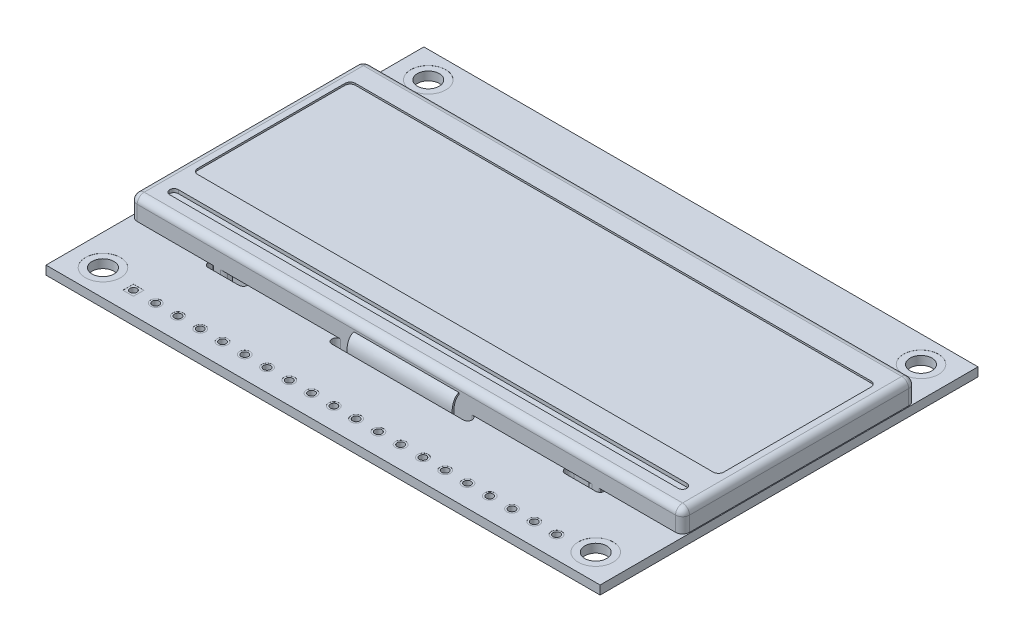
from build123d import *
from build123d.topology import SkipClean

# Parameters (mm, degrees)
SKETCH1_W           = 63.2
SKETCH1_H           = 43.1
BOSS_EXTRUDE1_DEPTH = 1
CUT_EXTRUDE1_REACH  = 78.504
SKETCH2_R           = 1.25
CUT_EXTRUDE2_REACH  = 78.504
SKETCH3_R           = 0.4
SKETCH4_W           = 63
SKETCH4_H           = 26.6
BOSS_EXTRUDE2_DEPTH = 2.5
CUT_EXTRUDE3_REACH  = 78.538
SKETCH5_W           = 16
SKETCH5_H           = 1
FILLET1_R           = 0.5
CUT_EXTRUDE4_DEPTH  = 0.2
SKETCH7_W           = 59
SKETCH7_H           = 1
CUT_EXTRUDE5_DEPTH  = 0.4
FILLET2_R           = 0.5
FILLET3_R           = 0.8
FILLET4_R           = 0.8
SKETCH8_W           = 4.5
SKETCH8_H           = 1
CUT_EXTRUDE6_DEPTH  = 1
FILLET5_R           = 0.5
SKETCH9_W           = 17
SKETCH9_H           = 4
BOSS_EXTRUDE3_DEPTH = 2
SKETCH10_W          = 13
SKETCH10_H          = 2
CUT_EXTRUDE7_DEPTH  = 0.4
SKETCH12_W          = 12
SKETCH12_H          = 0.2
SKETCH14_R          = 2
CUT_EXTRUDE8_DEPTH  = 0.01
SKETCH15_W          = 1.2
SKETCH15_H          = 1.2
CUT_EXTRUDE9_DEPTH  = 0.01
SKETCH16_R          = 0.6
CUT_EXTRUDE10_DEPTH = 0.01
CUT_EXTRUDE11_START = -0.01
SKETCH17_R          = 2
CUT_EXTRUDE11_DEPTH = 0.01
SKETCH18_W          = 1.75
SKETCH18_H          = 0.5
BOSS_EXTRUDE4_DEPTH = 1
CHAMFER1_SIZE       = 0.5
BOSS_EXTRUDE5_DEPTH = 1.2
FILLET6_R           = 0.8
FILLET7_R           = 0.1
SKETCH20_W          = 1.2
SKETCH20_H          = 1.2
CUT_EXTRUDE12_DEPTH = 0.01
CUT_EXTRUDE16_START = -0.01
SKETCH23_R          = 0.6
CUT_EXTRUDE16_DEPTH = 0.01


# Some blends are built 0.0001 mm under size
with BuildPart() as part:
    # Sketch1 → Boss-Extrude1 (new body)
    with BuildSketch(Plane(origin=(0, 0, 0), x_dir=(1, 0, 0), z_dir=(0, 1, 0))):
        with Locations((31.6, 21.55)):
            Rectangle(SKETCH1_W, SKETCH1_H)
    extrude(amount=BOSS_EXTRUDE1_DEPTH)

    # Sketch2 → Cut-Extrude1 (cut, up to next)
    with BuildSketch(Plane(origin=(0, 1, 0), x_dir=(1, 0, 0), z_dir=(0, 1, 0)), mode=Mode.PRIVATE) as cut_extrude1_sk1:
        with Locations(Location((3.5, 40.1, 0), (0, 0, 270))):
            Circle(SKETCH2_R)
    cut_extrude1_tool1 = extrude(cut_extrude1_sk1.sketch, amount=-CUT_EXTRUDE1_REACH, mode=Mode.PRIVATE) & part.part
    # Sketch2 → Cut-Extrude1 (cut, up to next)
    with BuildSketch(Plane(origin=(0, 1, 0), x_dir=(1, 0, 0), z_dir=(0, 1, 0)), mode=Mode.PRIVATE) as cut_extrude1_sk2:
        with Locations(Location((59.7, 40.1, 0), (0, 0, 270))):
            Circle(SKETCH2_R)
    cut_extrude1_tool2 = extrude(cut_extrude1_sk2.sketch, amount=-CUT_EXTRUDE1_REACH, mode=Mode.PRIVATE) & part.part
    # Sketch2 → Cut-Extrude1 (cut, up to next)
    with BuildSketch(Plane(origin=(0, 1, 0), x_dir=(1, 0, 0), z_dir=(0, 1, 0)), mode=Mode.PRIVATE) as cut_extrude1_sk3:
        with Locations(Location((59.7, 3, 0), (0, 0, 270))):
            Circle(SKETCH2_R)
    cut_extrude1_tool3 = extrude(cut_extrude1_sk3.sketch, amount=-CUT_EXTRUDE1_REACH, mode=Mode.PRIVATE) & part.part
    # Sketch2 → Cut-Extrude1 (cut, up to next)
    with BuildSketch(Plane(origin=(0, 1, 0), x_dir=(1, 0, 0), z_dir=(0, 1, 0)), mode=Mode.PRIVATE) as cut_extrude1_sk4:
        with Locations(Location((3.5, 3, 0), (0, 0, 270))):
            Circle(SKETCH2_R)
    cut_extrude1_tool4 = extrude(cut_extrude1_sk4.sketch, amount=-CUT_EXTRUDE1_REACH, mode=Mode.PRIVATE) & part.part
    add(cut_extrude1_tool1.solids().sort_by_distance((3.5, 1, -40.1))[0], mode=Mode.SUBTRACT)
    add(cut_extrude1_tool2.solids().sort_by_distance((59.7, 1, -40.1))[0], mode=Mode.SUBTRACT)
    add(cut_extrude1_tool3.solids().sort_by_distance((59.7, 1, -3))[0], mode=Mode.SUBTRACT)
    add(cut_extrude1_tool4.solids().sort_by_distance((3.5, 1, -3))[0], mode=Mode.SUBTRACT)

    # Sketch3 → Cut-Extrude2 (cut, up to next)
    with BuildSketch(Plane(origin=(0, 1, 0), x_dir=(1, 0, 0), z_dir=(0, 1, 0)), mode=Mode.PRIVATE) as cut_extrude2_sk1:
        with Locations(Location((7.47, 2.5, 0), (0, 0, 270))):
            Circle(SKETCH3_R)
    cut_extrude2_tool1 = extrude(cut_extrude2_sk1.sketch, amount=-CUT_EXTRUDE2_REACH, mode=Mode.PRIVATE) & part.part
    # Sketch3 → Cut-Extrude2 (cut, up to next)
    with BuildSketch(Plane(origin=(0, 1, 0), x_dir=(1, 0, 0), z_dir=(0, 1, 0)), mode=Mode.PRIVATE) as cut_extrude2_sk2:
        with Locations(Location((10.01, 2.5, 0), (0, 0, 270))):
            Circle(SKETCH3_R)
    cut_extrude2_tool2 = extrude(cut_extrude2_sk2.sketch, amount=-CUT_EXTRUDE2_REACH, mode=Mode.PRIVATE) & part.part
    # Sketch3 → Cut-Extrude2 (cut, up to next)
    with BuildSketch(Plane(origin=(0, 1, 0), x_dir=(1, 0, 0), z_dir=(0, 1, 0)), mode=Mode.PRIVATE) as cut_extrude2_sk3:
        with Locations(Location((12.55, 2.5, 0), (0, 0, 270))):
            Circle(SKETCH3_R)
    cut_extrude2_tool3 = extrude(cut_extrude2_sk3.sketch, amount=-CUT_EXTRUDE2_REACH, mode=Mode.PRIVATE) & part.part
    # Sketch3 → Cut-Extrude2 (cut, up to next)
    with BuildSketch(Plane(origin=(0, 1, 0), x_dir=(1, 0, 0), z_dir=(0, 1, 0)), mode=Mode.PRIVATE) as cut_extrude2_sk4:
        with Locations(Location((15.09, 2.5, 0), (0, 0, 270))):
            Circle(SKETCH3_R)
    cut_extrude2_tool4 = extrude(cut_extrude2_sk4.sketch, amount=-CUT_EXTRUDE2_REACH, mode=Mode.PRIVATE) & part.part
    # Sketch3 → Cut-Extrude2 (cut, up to next)
    with BuildSketch(Plane(origin=(0, 1, 0), x_dir=(1, 0, 0), z_dir=(0, 1, 0)), mode=Mode.PRIVATE) as cut_extrude2_sk5:
        with Locations(Location((17.63, 2.5, 0), (0, 0, 270))):
            Circle(SKETCH3_R)
    cut_extrude2_tool5 = extrude(cut_extrude2_sk5.sketch, amount=-CUT_EXTRUDE2_REACH, mode=Mode.PRIVATE) & part.part
    # Sketch3 → Cut-Extrude2 (cut, up to next)
    with BuildSketch(Plane(origin=(0, 1, 0), x_dir=(1, 0, 0), z_dir=(0, 1, 0)), mode=Mode.PRIVATE) as cut_extrude2_sk6:
        with Locations(Location((20.17, 2.5, 0), (0, 0, 270))):
            Circle(SKETCH3_R)
    cut_extrude2_tool6 = extrude(cut_extrude2_sk6.sketch, amount=-CUT_EXTRUDE2_REACH, mode=Mode.PRIVATE) & part.part
    # Sketch3 → Cut-Extrude2 (cut, up to next)
    with BuildSketch(Plane(origin=(0, 1, 0), x_dir=(1, 0, 0), z_dir=(0, 1, 0)), mode=Mode.PRIVATE) as cut_extrude2_sk7:
        with Locations(Location((22.71, 2.5, 0), (0, 0, 270))):
            Circle(SKETCH3_R)
    cut_extrude2_tool7 = extrude(cut_extrude2_sk7.sketch, amount=-CUT_EXTRUDE2_REACH, mode=Mode.PRIVATE) & part.part
    # Sketch3 → Cut-Extrude2 (cut, up to next)
    with BuildSketch(Plane(origin=(0, 1, 0), x_dir=(1, 0, 0), z_dir=(0, 1, 0)), mode=Mode.PRIVATE) as cut_extrude2_sk8:
        with Locations(Location((25.25, 2.5, 0), (0, 0, 270))):
            Circle(SKETCH3_R)
    cut_extrude2_tool8 = extrude(cut_extrude2_sk8.sketch, amount=-CUT_EXTRUDE2_REACH, mode=Mode.PRIVATE) & part.part
    # Sketch3 → Cut-Extrude2 (cut, up to next)
    with BuildSketch(Plane(origin=(0, 1, 0), x_dir=(1, 0, 0), z_dir=(0, 1, 0)), mode=Mode.PRIVATE) as cut_extrude2_sk9:
        with Locations(Location((27.79, 2.5, 0), (0, 0, 270))):
            Circle(SKETCH3_R)
    cut_extrude2_tool9 = extrude(cut_extrude2_sk9.sketch, amount=-CUT_EXTRUDE2_REACH, mode=Mode.PRIVATE) & part.part
    # Sketch3 → Cut-Extrude2 (cut, up to next)
    with BuildSketch(Plane(origin=(0, 1, 0), x_dir=(1, 0, 0), z_dir=(0, 1, 0)), mode=Mode.PRIVATE) as cut_extrude2_sk10:
        with Locations(Location((30.33, 2.5, 0), (0, 0, 270))):
            Circle(SKETCH3_R)
    cut_extrude2_tool10 = extrude(cut_extrude2_sk10.sketch, amount=-CUT_EXTRUDE2_REACH, mode=Mode.PRIVATE) & part.part
    # Sketch3 → Cut-Extrude2 (cut, up to next)
    with BuildSketch(Plane(origin=(0, 1, 0), x_dir=(1, 0, 0), z_dir=(0, 1, 0)), mode=Mode.PRIVATE) as cut_extrude2_sk11:
        with Locations(Location((32.87, 2.5, 0), (0, 0, 270))):
            Circle(SKETCH3_R)
    cut_extrude2_tool11 = extrude(cut_extrude2_sk11.sketch, amount=-CUT_EXTRUDE2_REACH, mode=Mode.PRIVATE) & part.part
    # Sketch3 → Cut-Extrude2 (cut, up to next)
    with BuildSketch(Plane(origin=(0, 1, 0), x_dir=(1, 0, 0), z_dir=(0, 1, 0)), mode=Mode.PRIVATE) as cut_extrude2_sk12:
        with Locations(Location((35.41, 2.5, 0), (0, 0, 270))):
            Circle(SKETCH3_R)
    cut_extrude2_tool12 = extrude(cut_extrude2_sk12.sketch, amount=-CUT_EXTRUDE2_REACH, mode=Mode.PRIVATE) & part.part
    # Sketch3 → Cut-Extrude2 (cut, up to next)
    with BuildSketch(Plane(origin=(0, 1, 0), x_dir=(1, 0, 0), z_dir=(0, 1, 0)), mode=Mode.PRIVATE) as cut_extrude2_sk13:
        with Locations(Location((37.95, 2.5, 0), (0, 0, 270))):
            Circle(SKETCH3_R)
    cut_extrude2_tool13 = extrude(cut_extrude2_sk13.sketch, amount=-CUT_EXTRUDE2_REACH, mode=Mode.PRIVATE) & part.part
    # Sketch3 → Cut-Extrude2 (cut, up to next)
    with BuildSketch(Plane(origin=(0, 1, 0), x_dir=(1, 0, 0), z_dir=(0, 1, 0)), mode=Mode.PRIVATE) as cut_extrude2_sk14:
        with Locations(Location((40.49, 2.5, 0), (0, 0, 270))):
            Circle(SKETCH3_R)
    cut_extrude2_tool14 = extrude(cut_extrude2_sk14.sketch, amount=-CUT_EXTRUDE2_REACH, mode=Mode.PRIVATE) & part.part
    # Sketch3 → Cut-Extrude2 (cut, up to next)
    with BuildSketch(Plane(origin=(0, 1, 0), x_dir=(1, 0, 0), z_dir=(0, 1, 0)), mode=Mode.PRIVATE) as cut_extrude2_sk15:
        with Locations(Location((43.03, 2.5, 0), (0, 0, 270))):
            Circle(SKETCH3_R)
    cut_extrude2_tool15 = extrude(cut_extrude2_sk15.sketch, amount=-CUT_EXTRUDE2_REACH, mode=Mode.PRIVATE) & part.part
    # Sketch3 → Cut-Extrude2 (cut, up to next)
    with BuildSketch(Plane(origin=(0, 1, 0), x_dir=(1, 0, 0), z_dir=(0, 1, 0)), mode=Mode.PRIVATE) as cut_extrude2_sk16:
        with Locations(Location((45.57, 2.5, 0), (0, 0, 270))):
            Circle(SKETCH3_R)
    cut_extrude2_tool16 = extrude(cut_extrude2_sk16.sketch, amount=-CUT_EXTRUDE2_REACH, mode=Mode.PRIVATE) & part.part
    # Sketch3 → Cut-Extrude2 (cut, up to next)
    with BuildSketch(Plane(origin=(0, 1, 0), x_dir=(1, 0, 0), z_dir=(0, 1, 0)), mode=Mode.PRIVATE) as cut_extrude2_sk17:
        with Locations(Location((48.11, 2.5, 0), (0, 0, 270))):
            Circle(SKETCH3_R)
    cut_extrude2_tool17 = extrude(cut_extrude2_sk17.sketch, amount=-CUT_EXTRUDE2_REACH, mode=Mode.PRIVATE) & part.part
    # Sketch3 → Cut-Extrude2 (cut, up to next)
    with BuildSketch(Plane(origin=(0, 1, 0), x_dir=(1, 0, 0), z_dir=(0, 1, 0)), mode=Mode.PRIVATE) as cut_extrude2_sk18:
        with Locations(Location((50.65, 2.5, 0), (0, 0, 270))):
            Circle(SKETCH3_R)
    cut_extrude2_tool18 = extrude(cut_extrude2_sk18.sketch, amount=-CUT_EXTRUDE2_REACH, mode=Mode.PRIVATE) & part.part
    # Sketch3 → Cut-Extrude2 (cut, up to next)
    with BuildSketch(Plane(origin=(0, 1, 0), x_dir=(1, 0, 0), z_dir=(0, 1, 0)), mode=Mode.PRIVATE) as cut_extrude2_sk19:
        with Locations(Location((53.19, 2.5, 0), (0, 0, 270))):
            Circle(SKETCH3_R)
    cut_extrude2_tool19 = extrude(cut_extrude2_sk19.sketch, amount=-CUT_EXTRUDE2_REACH, mode=Mode.PRIVATE) & part.part
    # Sketch3 → Cut-Extrude2 (cut, up to next)
    with BuildSketch(Plane(origin=(0, 1, 0), x_dir=(1, 0, 0), z_dir=(0, 1, 0)), mode=Mode.PRIVATE) as cut_extrude2_sk20:
        with Locations(Location((55.73, 2.5, 0), (0, 0, 270))):
            Circle(SKETCH3_R)
    cut_extrude2_tool20 = extrude(cut_extrude2_sk20.sketch, amount=-CUT_EXTRUDE2_REACH, mode=Mode.PRIVATE) & part.part
    add(cut_extrude2_tool1.solids().sort_by_distance((7.47, 1, -2.5))[0], mode=Mode.SUBTRACT)
    add(cut_extrude2_tool2.solids().sort_by_distance((10.01, 1, -2.5))[0], mode=Mode.SUBTRACT)
    add(cut_extrude2_tool3.solids().sort_by_distance((12.55, 1, -2.5))[0], mode=Mode.SUBTRACT)
    add(cut_extrude2_tool4.solids().sort_by_distance((15.09, 1, -2.5))[0], mode=Mode.SUBTRACT)
    add(cut_extrude2_tool5.solids().sort_by_distance((17.63, 1, -2.5))[0], mode=Mode.SUBTRACT)
    add(cut_extrude2_tool6.solids().sort_by_distance((20.17, 1, -2.5))[0], mode=Mode.SUBTRACT)
    add(cut_extrude2_tool7.solids().sort_by_distance((22.71, 1, -2.5))[0], mode=Mode.SUBTRACT)
    add(cut_extrude2_tool8.solids().sort_by_distance((25.25, 1, -2.5))[0], mode=Mode.SUBTRACT)
    add(cut_extrude2_tool9.solids().sort_by_distance((27.79, 1, -2.5))[0], mode=Mode.SUBTRACT)
    add(cut_extrude2_tool10.solids().sort_by_distance((30.33, 1, -2.5))[0], mode=Mode.SUBTRACT)
    add(cut_extrude2_tool11.solids().sort_by_distance((32.87, 1, -2.5))[0], mode=Mode.SUBTRACT)
    add(cut_extrude2_tool12.solids().sort_by_distance((35.41, 1, -2.5))[0], mode=Mode.SUBTRACT)
    add(cut_extrude2_tool13.solids().sort_by_distance((37.95, 1, -2.5))[0], mode=Mode.SUBTRACT)
    add(cut_extrude2_tool14.solids().sort_by_distance((40.49, 1, -2.5))[0], mode=Mode.SUBTRACT)
    add(cut_extrude2_tool15.solids().sort_by_distance((43.03, 1, -2.5))[0], mode=Mode.SUBTRACT)
    add(cut_extrude2_tool16.solids().sort_by_distance((45.57, 1, -2.5))[0], mode=Mode.SUBTRACT)
    add(cut_extrude2_tool17.solids().sort_by_distance((48.11, 1, -2.5))[0], mode=Mode.SUBTRACT)
    add(cut_extrude2_tool18.solids().sort_by_distance((50.65, 1, -2.5))[0], mode=Mode.SUBTRACT)
    add(cut_extrude2_tool19.solids().sort_by_distance((53.19, 1, -2.5))[0], mode=Mode.SUBTRACT)
    add(cut_extrude2_tool20.solids().sort_by_distance((55.73, 1, -2.5))[0], mode=Mode.SUBTRACT)

    # Sketch4 → Boss-Extrude2 (add)
    with BuildSketch(Plane(origin=(0, 1, 0), x_dir=(1, 0, 0), z_dir=(0, 1, 0))):
        with Locations((31.6, 22.8)):
            Rectangle(SKETCH4_W, SKETCH4_H)
    extrude(amount=BOSS_EXTRUDE2_DEPTH)

    # Sketch5 → Cut-Extrude3 (cut, up to next)
    with BuildSketch(Plane(origin=(0, 1, 0), x_dir=(1, 0, 0), z_dir=(0, 1, 0)), mode=Mode.PRIVATE) as cut_extrude3_sk1:
        with Locations((31.6, 9)):
            Rectangle(SKETCH5_W, SKETCH5_H)
    cut_extrude3_tool1 = extrude(cut_extrude3_sk1.sketch, amount=-CUT_EXTRUDE3_REACH, mode=Mode.PRIVATE) & part.part
    add(cut_extrude3_tool1.solids().sort_by_distance((31.6, 1, -9))[0], mode=Mode.SUBTRACT)

    # Fillet1
    fillet1_edges = [part.edges().sort_by_distance(p)[0] for p in [
        (39.6, 0.5, -8.5),
        (39.6, 0.5, -9.5),
        (23.6, 0.5, -8.5),
        (23.6, 0.5, -9.5),
    ]]
    fillet(fillet1_edges, radius=FILLET1_R - 0.0001)  # a hair under: the kernel refuses the full size

    # Sketch6 → Cut-Extrude4 (cut)
    with BuildSketch(Plane(origin=(0, 3.5, 0), x_dir=(1, 0, 0), z_dir=(0, 1, 0))):
        with BuildLine():
            Line((2.2, 33.1), (61, 33.1))
            ThreePointArc((61, 33.1), (61.424264069, 32.924264069), (61.6, 32.5))
            Line((61.6, 32.5), (61.6, 15.7))
            ThreePointArc((61.6, 15.7), (61.424264069, 15.275735931), (61, 15.1))
            Line((61, 15.1), (2.2, 15.1))
            ThreePointArc((2.2, 15.1), (1.775735931, 15.275735931), (1.6, 15.7))
            Line((1.6, 15.7), (1.6, 32.5))
            ThreePointArc((1.6, 32.5), (1.775735931, 32.924264069), (2.2, 33.1))
        make_face()
    extrude(amount=-CUT_EXTRUDE4_DEPTH, mode=Mode.SUBTRACT)

    # Sketch7 → Cut-Extrude5 (cut)
    with BuildSketch(Plane(origin=(0, 3.5, 0), x_dir=(1, 0, 0), z_dir=(0, 1, 0))):
        with Locations((31.6, 12)):
            Rectangle(SKETCH7_W, SKETCH7_H)
    extrude(amount=-CUT_EXTRUDE5_DEPTH, mode=Mode.SUBTRACT)

    # Fillet2
    fillet2_edges = [part.edges().sort_by_distance(p)[0] for p in [
        (61.1, 3.3, -11.5),
        (61.1, 3.3, -12.5),
        (2.1, 3.3, -11.5),
        (2.1, 3.3, -12.5),
    ]]
    fillet(fillet2_edges, radius=FILLET2_R - 0.0001)  # a hair under: the kernel refuses the full size

    # Fillet3
    fillet3_edges = [part.edges().sort_by_distance(p)[0] for p in [
        (0.1, 2.25, -36.1),
        (0.1, 2.25, -9.5),
        (63.1, 2.25, -9.5),
        (63.1, 2.25, -36.1),
    ]]
    fillet(fillet3_edges, radius=FILLET3_R)

    # Fillet4
    fillet4_edges = [part.edges().sort_by_distance(p)[0] for p in [
        (31.6, 3.5, -36.1),
        (63.1, 3.5, -22.8),
        (0.1, 3.5, -22.8),
        (31.6, 3.5, -9.5),
        (0.334314575, 3.5, -35.865685425),
        (0.334314575, 3.5, -9.734314575),
        (62.865685425, 3.5, -9.734314575),
        (62.865685425, 3.5, -35.865685425),
    ]]
    fillet(fillet4_edges, radius=FILLET4_R)

    # Sketch8 → Cut-Extrude6 (cut)
    with BuildSketch(Plane.XZ):
        with Locations((51.95, -9.5)):
            Rectangle(SKETCH8_W, SKETCH8_H)
        with Locations((11.25, -9.5)):
            Rectangle(SKETCH8_W, SKETCH8_H)
        with Locations((11.25, -36.1)):
            Rectangle(SKETCH8_W, SKETCH8_H)
        with Locations((51.95, -36.1)):
            Rectangle(SKETCH8_W, SKETCH8_H)
    extrude(amount=-CUT_EXTRUDE6_DEPTH, mode=Mode.SUBTRACT)

    # Fillet5
    fillet5_edges = [part.edges().sort_by_distance(p)[0] for p in [
        (13.5, 0.5, -9),
        (13.5, 0.5, -10),
        (9, 0.5, -10),
        (9, 0.5, -9),
        (13.5, 0.5, -35.6),
        (13.5, 0.5, -36.6),
        (9, 0.5, -35.6),
        (9, 0.5, -36.6),
        (49.7, 0.5, -9),
        (49.7, 0.5, -10),
        (54.2, 0.5, -9),
        (54.2, 0.5, -10),
        (49.7, 0.5, -35.6),
        (49.7, 0.5, -36.6),
        (54.2, 0.5, -35.6),
        (54.2, 0.5, -36.6),
    ]]
    fillet(fillet5_edges, radius=FILLET5_R - 0.0001)  # a hair under: the kernel refuses the full size

    # Sketch9 → Boss-Extrude3 (add)
    with BuildSketch(Plane.XZ):
        with Locations((31.6, -40.1)):
            Rectangle(SKETCH9_W, SKETCH9_H)
    extrude(amount=BOSS_EXTRUDE3_DEPTH)

    # Sketch10 → Cut-Extrude7 (cut)
    with BuildSketch(Plane(origin=(0, 0, -42.1), x_dir=(-1, 0, 0), z_dir=(0, 0, -1))):
        with Locations((-31.6, -1)):
            Rectangle(SKETCH10_W, SKETCH10_H)
    extrude(amount=-CUT_EXTRUDE7_DEPTH, mode=Mode.SUBTRACT)

    # Sweep2: sweep along a path in Sketch13
    with BuildLine() as sweep2_path:  # in the path sketch's own coordinates; laid on its plane below (add() does not lay a ready-made edge on the line's plane)
        add(Edge.make_bspline(
            [(38.1, -0.982874857), (31.693367937, -1.195153262), (28.241433931, -1.402191769), (7.916516179, -4.95738453), (8.854522638, 2.143849397), (9.538601565, 2.350278671)],
            knots=[0, 0, 0, 0, 0.344257494, 0.890734915, 1, 1, 1, 1], degree=3))
    # Sketch12 → Sweep2 (sweep)
    with BuildSketch(Plane.XY.offset(-38.1)):
        with Locations((31.6, -1)):
            Rectangle(SKETCH12_W, SKETCH12_H)
    sweep(path=Plane(origin=(31.6, 0, 0), x_dir=(0, 0, -1), z_dir=(1, 0, 0)) * sweep2_path.line)

    # Sketch14 → Cut-Extrude8 (cut)
    with BuildSketch(Plane(origin=(0, 1, 0), x_dir=(1, 0, 0), z_dir=(0, 1, 0))):
        with Locations(Location((3.5, 40.1, 0), (0, 0, 270))):
            Circle(SKETCH14_R)
        with Locations(Location((59.7, 40.1, 0), (0, 0, 270))):
            Circle(SKETCH14_R)
        with Locations(Location((59.7, 3, 0), (0, 0, 270))):
            Circle(SKETCH14_R)
        with Locations(Location((3.5, 3, 0), (0, 0, 270))):
            Circle(SKETCH14_R)
    extrude(amount=-CUT_EXTRUDE8_DEPTH, mode=Mode.SUBTRACT)

    # Sketch15 → Cut-Extrude9 (cut)
    with BuildSketch(Plane(origin=(0, 1, 0), x_dir=(1, 0, 0), z_dir=(0, 1, 0))):
        with Locations((7.47, 2.5)):
            Rectangle(SKETCH15_W, SKETCH15_H)
    extrude(amount=-CUT_EXTRUDE9_DEPTH, mode=Mode.SUBTRACT)

    # Sketch16 → Cut-Extrude10 (cut)
    with BuildSketch(Plane(origin=(0, 1, 0), x_dir=(1, 0, 0), z_dir=(0, 1, 0))):
        with Locations(Location((10.01, 2.5, 0), (0, 0, 270))):
            Circle(SKETCH16_R)
        with Locations(Location((12.55, 2.5, 0), (0, 0, 270))):
            Circle(SKETCH16_R)
        with Locations(Location((15.09, 2.5, 0), (0, 0, 270))):
            Circle(SKETCH16_R)
        with Locations(Location((17.63, 2.5, 0), (0, 0, 270))):
            Circle(SKETCH16_R)
        with Locations(Location((20.17, 2.5, 0), (0, 0, 270))):
            Circle(SKETCH16_R)
        with Locations(Location((22.71, 2.5, 0), (0, 0, 270))):
            Circle(SKETCH16_R)
        with Locations(Location((25.25, 2.5, 0), (0, 0, 270))):
            Circle(SKETCH16_R)
        with Locations(Location((27.79, 2.5, 0), (0, 0, 270))):
            Circle(SKETCH16_R)
        with Locations(Location((30.33, 2.5, 0), (0, 0, 270))):
            Circle(SKETCH16_R)
        with Locations(Location((32.87, 2.5, 0), (0, 0, 270))):
            Circle(SKETCH16_R)
        with Locations(Location((35.41, 2.5, 0), (0, 0, 270))):
            Circle(SKETCH16_R)
        with Locations(Location((37.95, 2.5, 0), (0, 0, 270))):
            Circle(SKETCH16_R)
        with Locations(Location((40.49, 2.5, 0), (0, 0, 270))):
            Circle(SKETCH16_R)
        with Locations(Location((43.03, 2.5, 0), (0, 0, 270))):
            Circle(SKETCH16_R)
        with Locations(Location((45.57, 2.5, 0), (0, 0, 270))):
            Circle(SKETCH16_R)
        with Locations(Location((48.11, 2.5, 0), (0, 0, 270))):
            Circle(SKETCH16_R)
        with Locations(Location((50.65, 2.5, 0), (0, 0, 270))):
            Circle(SKETCH16_R)
        with Locations(Location((53.19, 2.5, 0), (0, 0, 270))):
            Circle(SKETCH16_R)
        with Locations(Location((55.73, 2.5, 0), (0, 0, 270))):
            Circle(SKETCH16_R)
    extrude(amount=-CUT_EXTRUDE10_DEPTH, mode=Mode.SUBTRACT)

    # Sketch17 → Cut-Extrude11 (cut)
    with BuildSketch(Plane.XZ.offset(CUT_EXTRUDE11_START)):
        with Locations(Location((59.7, -40.1, 0), (0, 0, 90))):
            Circle(SKETCH17_R)
        with Locations(Location((3.5, -40.1, 0), (0, 0, 90))):
            Circle(SKETCH17_R)
        with Locations(Location((3.5, -3, 0), (0, 0, 90))):
            Circle(SKETCH17_R)
        with Locations(Location((59.7, -3, 0), (0, 0, 90))):
            Circle(SKETCH17_R)
    extrude(amount=CUT_EXTRUDE11_DEPTH, mode=Mode.SUBTRACT)

    # Sketch18 → Boss-Extrude4 (add)
    with BuildSketch(Plane.XZ.offset(-1)):
        with Locations((52.825, -35.85)):
            Rectangle(SKETCH18_W, SKETCH18_H)
        with Locations((10.375, -35.85)):
            Rectangle(SKETCH18_W, SKETCH18_H)
        with Locations((52.825, -9.75)):
            Rectangle(SKETCH18_W, SKETCH18_H)
        with Locations((10.375, -9.75)):
            Rectangle(SKETCH18_W, SKETCH18_H)
    extrude(amount=BOSS_EXTRUDE4_DEPTH)

    # Chamfer1
    chamfer1_edges = [part.edges().sort_by_distance(p)[0] for p in [
        (11.25, 0.5, -9.5),
        (11.25, 0.5, -36.1),
        (51.95, 0.5, -36.1),
        (51.95, 0.5, -9.5),
    ]]
    chamfer(chamfer1_edges, length=CHAMFER1_SIZE - 0.0001)  # a hair under: the kernel refuses the full size

    # Sketch19 → Boss-Extrude5 (add)
    with SkipClean():  # the faces are left unmerged after this step: merging them gives an invalid solid
        with BuildSketch(Plane(origin=(0, 0, 0), x_dir=(-1, 0, 0), z_dir=(0, -1, 0))):
            Polygon((-9.5, 9.5), (-10.75, 9.5), (-12.517766953, 11.267766953), (-12.164213562, 11.621320344), (-10.542893219, 10), (-9.5, 10), align=None)
            Polygon((-53.7, 9.5), (-52.45, 9.5), (-50.682233047, 11.267766953), (-51.035786438, 11.621320344), (-52.657106781, 10), (-53.7, 10), align=None)
            Polygon((-9.5, 36.1), (-10.75, 36.1), (-12.517766953, 34.332233047), (-12.164213562, 33.978679656), (-10.542893219, 35.6), (-9.5, 35.6), align=None)
            Polygon((-53.7, 36.1), (-52.45, 36.1), (-50.682233047, 34.332233047), (-51.035786438, 33.978679656), (-52.657106781, 35.6), (-53.7, 35.6), align=None)
        extrude(amount=BOSS_EXTRUDE5_DEPTH)

    # Fillet6
    fillet6_edges = [part.edges().sort_by_distance(p)[0] for p in [
        (52.45, -0.6, -36.1),
        (10.75, -0.6, -36.1),
        (10.75, -0.6, -9.5),
        (52.45, -0.6, -9.5),
        (10.542893219, -0.6, -10),
        (52.657106781, -0.6, -10),
        (10.542893219, -0.6, -35.6),
        (52.657106781, -0.6, -35.6),
    ]]
    fillet(fillet6_edges, radius=FILLET6_R)

    # Fillet7
    # the kernel refuses this fillet: 0.1 mm, written as the material it takes off along each edge
    with BuildSketch(Plane(origin=(53.7, 0, -36.1), x_dir=(-1, 0, 0), z_dir=(0, -1, 0)), Plane(origin=(9.5, 0, -9.5), x_dir=(1, 0, 0), z_dir=(0, -1, 0)), Plane(origin=(9.5, 0, -10), x_dir=(0, 0, 1), z_dir=(0, -1, 0)), Plane(origin=(12.164213562, 0, -11.621320344), x_dir=(-0.7071067811865476, 0, 0.7071067811865476), z_dir=(0, -1, 0)), Plane(origin=(12.517766953, 0, -11.267766953), x_dir=(-0.7071067811865475, 0, -0.7071067811865475), z_dir=(0, -1, 0)), Plane(origin=(53.7, 0, -10), x_dir=(-1, 0, 0), z_dir=(0, -1, 0)), Plane(origin=(9.5, 0, -35.6), x_dir=(1, 0, 0), z_dir=(0, -1, 0)), Plane(origin=(51.035786438, 0, -33.978679656), x_dir=(0.7071067811865476, 0, -0.7071067811865476), z_dir=(0, -1, 0)), Plane(origin=(50.682233047, 0, -34.332233047), x_dir=(0.7071067811865476, 0, 0.7071067811865476), z_dir=(0, -1, 0))) as fillet7_piece_1:
        with BuildLine():
            CenterArc((FILLET7_R, -FILLET7_R), FILLET7_R, 90, 90)
            Line((0, -FILLET7_R), (0, 0))
            Line((0, 0), (FILLET7_R, 0))
        make_face()
    extrude(amount=1.45, mode=Mode.SUBTRACT)
    with BuildSketch(Plane(origin=(9.5, 0, -36.1), x_dir=(1, 0, 0), z_dir=(0, -1, 0)), Plane(origin=(53.7, 0, -9.5), x_dir=(-1, 0, 0), z_dir=(0, -1, 0)), Plane(origin=(50.682233047, 0, -11.267766953), x_dir=(0.7071067811865563, 0, -0.7071067811865386), z_dir=(0, -1, 0)), Plane(origin=(51.035786438, 0, -11.621320344), x_dir=(0.7071067811865297, 0, 0.7071067811865652), z_dir=(0, -1, 0)), Plane(origin=(12.517766953, 0, -34.332233047), x_dir=(-0.7071067811865653, 0, 0.7071067811865298), z_dir=(0, -1, 0)), Plane(origin=(12.164213562, 0, -33.978679656), x_dir=(-0.7071067811865386, 0, -0.7071067811865563), z_dir=(0, -1, 0)), Plane(origin=(53.7, 0, -35.6), x_dir=(-1, 0, 0), z_dir=(0, -1, 0))) as fillet7_piece_2:
        with BuildLine():
            CenterArc((FILLET7_R, FILLET7_R), FILLET7_R, 180, 90)
            Line((0, FILLET7_R), (0, 0))
            Line((0, 0), (FILLET7_R, 0))
        make_face()
    extrude(amount=1.45, mode=Mode.SUBTRACT)
    with BuildSketch(Plane(origin=(9.5, 1, -9.5), x_dir=(1, 0, 0), z_dir=(0, -1, 0)), Plane(origin=(53.7, 1, -36.1), x_dir=(-1, 0, 0), z_dir=(0, -1, 0))) as fillet7_piece_3:
        with BuildLine():
            CenterArc((FILLET7_R, -FILLET7_R), FILLET7_R, 90, 90)
            Line((0, -FILLET7_R), (0, 0))
            Line((0, 0), (FILLET7_R, 0))
        make_face()
    extrude(amount=1, mode=Mode.SUBTRACT)
    with BuildSketch(Plane(origin=(53.7, 1, -9.5), x_dir=(-1, 0, 0), z_dir=(0, -1, 0)), Plane(origin=(9.5, 1, -36.1), x_dir=(1, 0, 0), z_dir=(0, -1, 0))) as fillet7_piece_4:
        with BuildLine():
            CenterArc((FILLET7_R, FILLET7_R), FILLET7_R, 180, 90)
            Line((0, FILLET7_R), (0, 0))
            Line((0, 0), (FILLET7_R, 0))
        make_face()
    extrude(amount=1, mode=Mode.SUBTRACT)

    # Sketch20 → Cut-Extrude12 (cut)
    with SkipClean():  # the faces are left unmerged after this step: merging them gives an invalid solid
        with BuildSketch(Plane.XZ):
            with Locations((7.47, -2.5)):
                Rectangle(SKETCH20_W, SKETCH20_H)
        extrude(amount=-CUT_EXTRUDE12_DEPTH, mode=Mode.SUBTRACT)

    # Sketch23 → Cut-Extrude16 (cut)
    with SkipClean():  # the faces are left unmerged after this step: merging them gives an invalid solid
        with BuildSketch(Plane.XZ.offset(CUT_EXTRUDE16_START)):
            with Locations(Location((10.01, -2.5, 0), (0, 0, 90))):
                Circle(SKETCH23_R)
            with Locations(Location((12.55, -2.5, 0), (0, 0, 90))):
                Circle(SKETCH23_R)
            with Locations(Location((15.09, -2.5, 0), (0, 0, 90))):
                Circle(SKETCH23_R)
            with Locations(Location((17.63, -2.5, 0), (0, 0, 90))):
                Circle(SKETCH23_R)
            with Locations(Location((20.17, -2.5, 0), (0, 0, 90))):
                Circle(SKETCH23_R)
            with Locations(Location((22.71, -2.5, 0), (0, 0, 90))):
                Circle(SKETCH23_R)
            with Locations(Location((25.25, -2.5, 0), (0, 0, 90))):
                Circle(SKETCH23_R)
            with Locations(Location((27.79, -2.5, 0), (0, 0, 90))):
                Circle(SKETCH23_R)
            with Locations(Location((30.33, -2.5, 0), (0, 0, 90))):
                Circle(SKETCH23_R)
            with Locations(Location((32.87, -2.5, 0), (0, 0, 90))):
                Circle(SKETCH23_R)
            with Locations(Location((35.41, -2.5, 0), (0, 0, 90))):
                Circle(SKETCH23_R)
            with Locations(Location((37.95, -2.5, 0), (0, 0, 90))):
                Circle(SKETCH23_R)
            with Locations(Location((40.49, -2.5, 0), (0, 0, 90))):
                Circle(SKETCH23_R)
            with Locations(Location((43.03, -2.5, 0), (0, 0, 90))):
                Circle(SKETCH23_R)
            with Locations(Location((45.57, -2.5, 0), (0, 0, 90))):
                Circle(SKETCH23_R)
            with Locations(Location((48.11, -2.5, 0), (0, 0, 90))):
                Circle(SKETCH23_R)
            with Locations(Location((50.65, -2.5, 0), (0, 0, 90))):
                Circle(SKETCH23_R)
            with Locations(Location((53.19, -2.5, 0), (0, 0, 90))):
                Circle(SKETCH23_R)
            with Locations(Location((55.73, -2.5, 0), (0, 0, 90))):
                Circle(SKETCH23_R)
        extrude(amount=CUT_EXTRUDE16_DEPTH, mode=Mode.SUBTRACT)


solid = part.part
